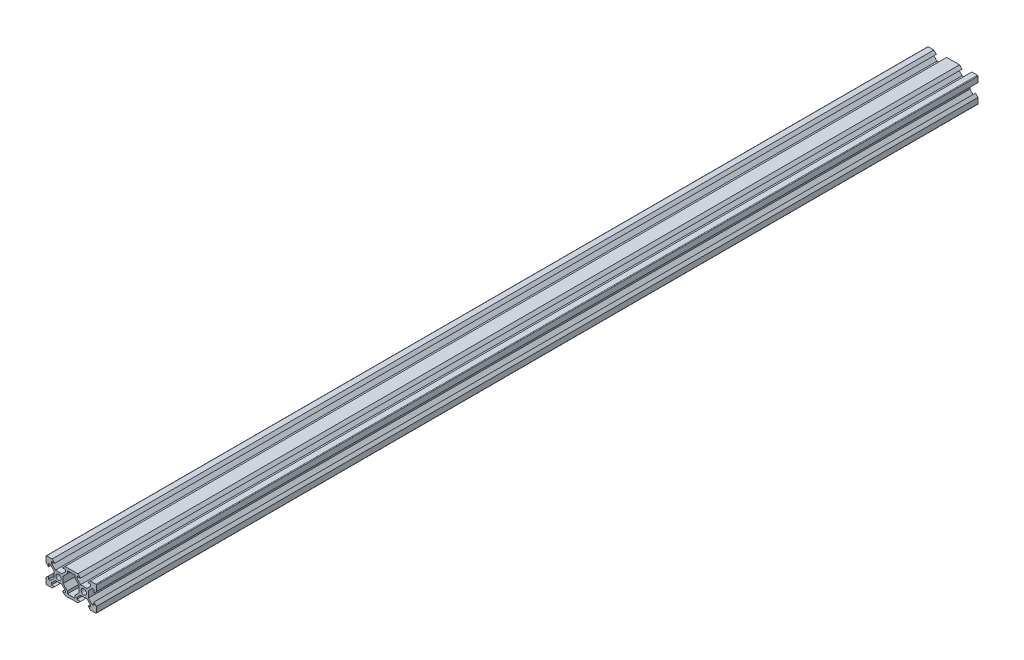
from build123d import *

# Parameters (mm, degrees)
SKETCH1_R           = 2.1
BOSS_EXTRUDE1_DEPTH = 700
FILLET1_R           = 0.5


with BuildPart() as part:
    # Sketch1 → Boss-Extrude1 (new body)
    with BuildSketch(Plane.XY):
        Polygon((-20, -10), (-15.5, -10), (-15.1, -10), (-13.1, -8), (-15.5, -8), (-15.5, -6.560660172), (-12.539339828, -3.6), (-7.460660172, -3.6), (-4.5, -6.560660172), (-4.5, -8), (-6.9, -8), (-4.9, -10), (5.313777138, -10), (7.313777138, -8), (4.5, -8), (4.5, -6.560660172), (7.460660172, -3.6), (12.539339828, -3.6), (15.5, -6.560660172), (15.5, -8), (13.513777138, -8), (15.1, -10), (15.5, -10), (20, -10), (20, -5.5), (20, -5.1), (18, -3.1), (18, -5.5), (16.560660172, -5.5), (13.6, -2.539339828), (13.6, 2.539339828), (16.560660172, 5.5), (18, 5.5), (18, 3.1), (20, 5.1), (20, 5.5), (20, 10), (15.5, 10), (15.1, 10), (13.1, 8), (15.5, 8), (15.5, 6.560660172), (12.539339828, 3.6), (7.460660172, 3.6), (4.5, 6.560660172), (4.5, 8), (7.313777138, 8), (5.313777138, 10), (-4.9, 10), (-6.9, 8), (-4.5, 8), (-4.5, 6.560660172), (-7.460660172, 3.6), (-12.539339828, 3.6), (-15.5, 6.560660172), (-15.5, 8), (-13.1, 8), (-15.1, 10), (-15.5, 10), (-20, 10), (-20, 5.5), (-20, 5.1), (-18, 3.1), (-18, 5.5), (-16.560660172, 5.5), (-13.6, 2.539339828), (-13.6, -2.539339828), (-16.560660172, -5.5), (-18, -5.5), (-18, -3.1), (-20, -5.1), (-20, -5.5), align=None)
        with Locations((-10, 0)):
            Circle(SKETCH1_R, mode=Mode.SUBTRACT)
        with Locations((10, 0)):
            Circle(SKETCH1_R, mode=Mode.SUBTRACT)
        Polygon((3, -5.939339828), (3, -8), (-3, -8), (-3, -5.939339828), (-6.4, -2.539339828), (-6.4, 2.539339828), (-3, 5.939339828), (-3, 8), (3, 8), (3, 5.939339828), (6.4, 2.539339828), (6.4, -2.539339828), align=None, mode=Mode.SUBTRACT)
    extrude(amount=BOSS_EXTRUDE1_DEPTH)

    # Fillet1
    fillet1_edges = [part.edges().sort_by_distance(p)[0] for p in [
        (-20, -10, 350),
        (-20, 10, 350),
        (20, -10, 350),
        (20, 10, 350),
    ]]
    fillet(fillet1_edges, radius=FILLET1_R)


solid = part.part
